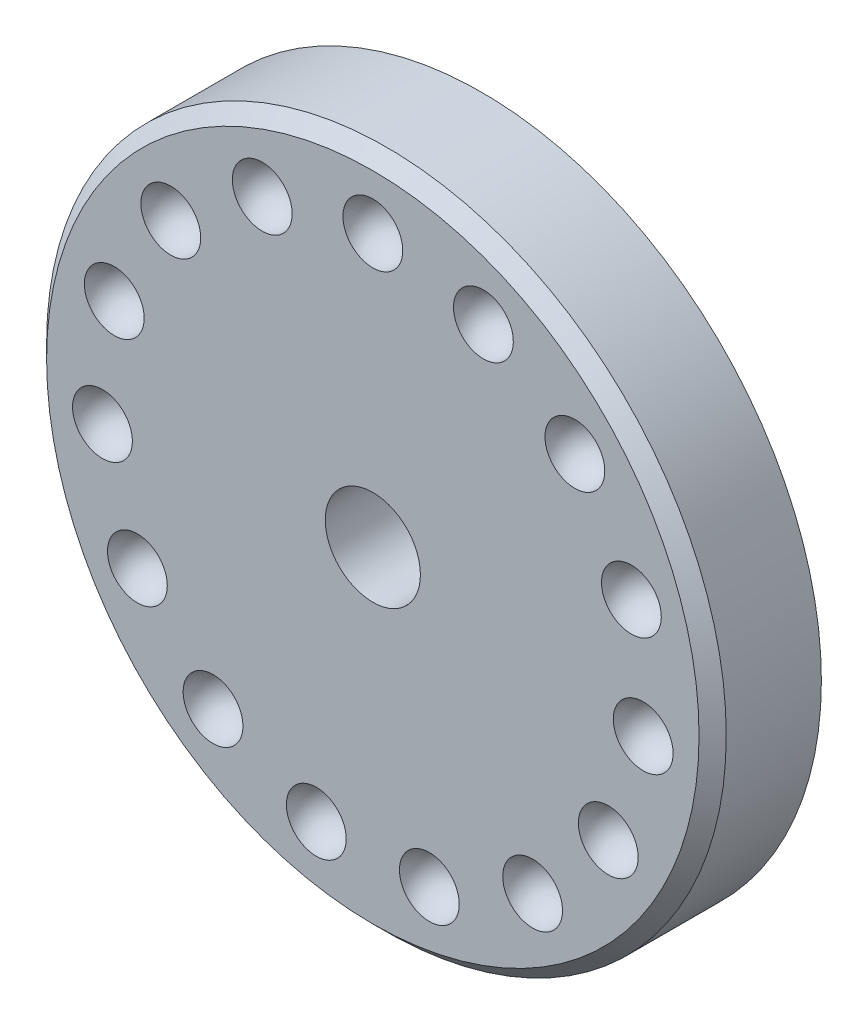
from build123d import *

# Parameters (mm, degrees)
SKETCH1_R           = 12.5
BOSS_EXTRUDE1_DEPTH = 4
CHAMFER1_SIZE       = 0.5
CIRPATTERN1_COUNT   = 15
SKETCH7_R           = 1.25
CUT_EXTRUDE1_DEPTH  = 19.12456896
SKETCH10_R          = 1.75
CUT_EXTRUDE2_DEPTH  = 19.12456896


with BuildPart() as part:
    # Sketch1 → Boss-Extrude1 (new body)
    with BuildSketch(Plane.XY):
        Circle(SKETCH1_R)
    extrude(amount=BOSS_EXTRUDE1_DEPTH)

    # Chamfer1
    chamfer1_edges = [part.edges().sort_by_distance(p)[0] for p in [
        (-12.5, 0, 4),
    ]]
    chamfer(chamfer1_edges, length=CHAMFER1_SIZE)

    # Sketch6 → Cut-Revolve2 (revolve, cut)
    with BuildSketch(Plane(origin=(0, 0, 0), x_dir=(0, 0, -1), z_dir=(1, 0, 0))):
        with BuildLine():
            Line((-4, 8.9), (-4, 11.1))
            ThreePointArc((-4, 11.1), (-5.1, 10), (-4, 8.9))
        make_face()
    cut_revolve2 = revolve(axis=Axis((0, 8.9, 4), (0, 1, 0)), mode=Mode.SUBTRACT)

    # CirPattern1: Cut-Revolve2 ×15 about axis
    cirpattern1_axis = Axis((0, 0, 3.5), (0, 0, -1))
    for i in range(1, CIRPATTERN1_COUNT):
        add(cut_revolve2.rotate(cirpattern1_axis, i * 360 / CIRPATTERN1_COUNT), mode=Mode.SUBTRACT)

    # Sketch7 → Cut-Extrude1 (cut, through all)
    with BuildSketch(Plane.XY.offset(4)):
        Circle(SKETCH7_R)
    extrude(amount=-CUT_EXTRUDE1_DEPTH, mode=Mode.SUBTRACT)

    # Sketch10 → Cut-Extrude2 (cut, through all)
    with BuildSketch(Plane.XY.offset(4)):
        Circle(SKETCH10_R)
    extrude(amount=-CUT_EXTRUDE2_DEPTH, mode=Mode.SUBTRACT)


solid = part.part
